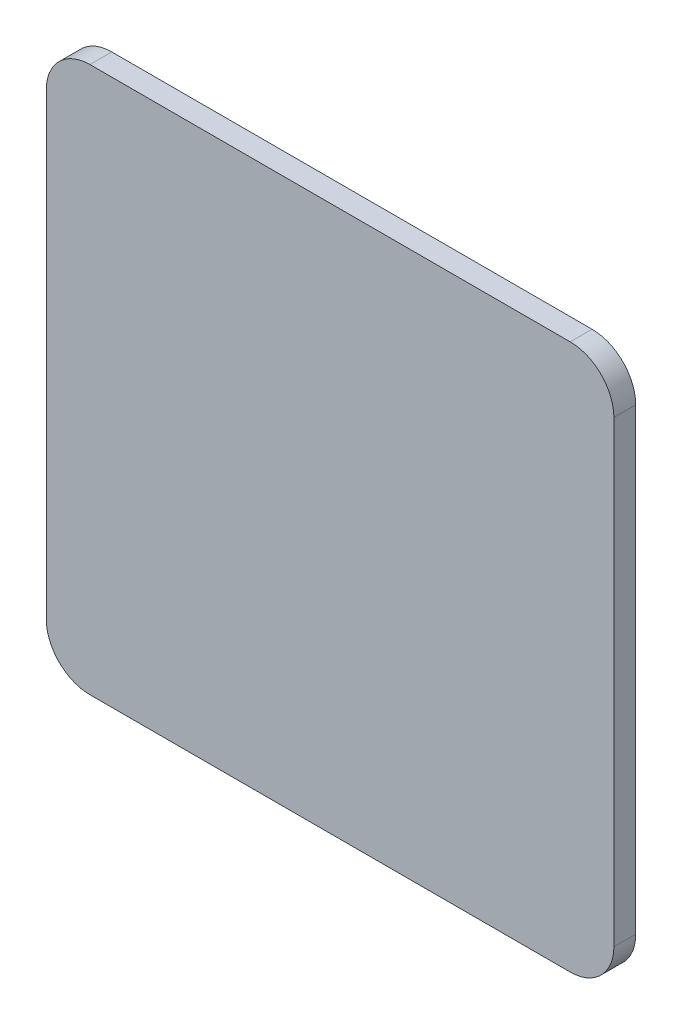
from build123d import *

# Parameters (mm, degrees)
BOSS_EXTRUDE1_DEPTH = 2.54


with BuildPart() as part:
    # Sketch1 → Boss-Extrude1 (new body)
    with BuildSketch(Plane.XY):
        with BuildLine():
            Line((-27.94, -31.75), (27.94, -31.75))
            ThreePointArc((27.94, -31.75), (31.532102448, -30.262102448), (33.02, -26.67))
            Line((33.02, -26.67), (33.02, 26.67))
            ThreePointArc((33.02, 26.67), (31.532102448, 30.262102448), (27.94, 31.75))
            Line((27.94, 31.75), (-27.94, 31.75))
            ThreePointArc((-27.94, 31.75), (-31.532102448, 30.262102448), (-33.02, 26.67))
            Line((-33.02, 26.67), (-33.02, -26.67))
            ThreePointArc((-33.02, -26.67), (-31.532102448, -30.262102448), (-27.94, -31.75))
        make_face()
    extrude(amount=BOSS_EXTRUDE1_DEPTH)


solid = part.part
